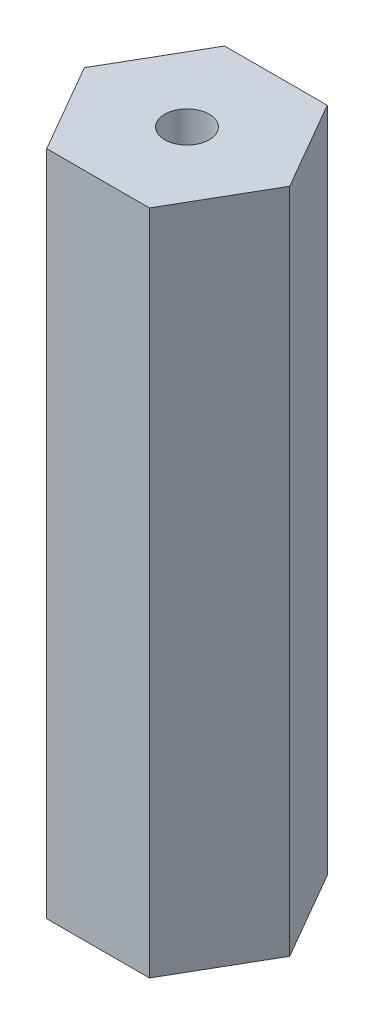
from build123d import *

# Parameters (mm, degrees)
BOSS_EXTRUDE1_DEPTH = 47.625
SKETCH2_R           = 3.175
CUT_EXTRUDE1_DEPTH  = 98.205482527


with BuildPart() as part:
    # Sketch1 → Boss-Extrude1 (new, symmetric)
    with BuildSketch(Plane(origin=(0, 0, 0), x_dir=(1, 0, 0), z_dir=(0, 1, 0))):
        Polygon((-14.664696837, 0), (-7.332348419, -12.7), (7.332348419, -12.7), (14.664696837, 0), (7.332348419, 12.7), (-7.332348419, 12.7), align=None)
    extrude(amount=BOSS_EXTRUDE1_DEPTH, both=True)

    # Sketch2 → Cut-Extrude1 (cut, through all)
    with BuildSketch(Plane(origin=(0, 47.625, 0), x_dir=(1, 0, 0), z_dir=(0, 1, 0))):
        Circle(SKETCH2_R)
    extrude(amount=-CUT_EXTRUDE1_DEPTH, mode=Mode.SUBTRACT)


solid = part.part
